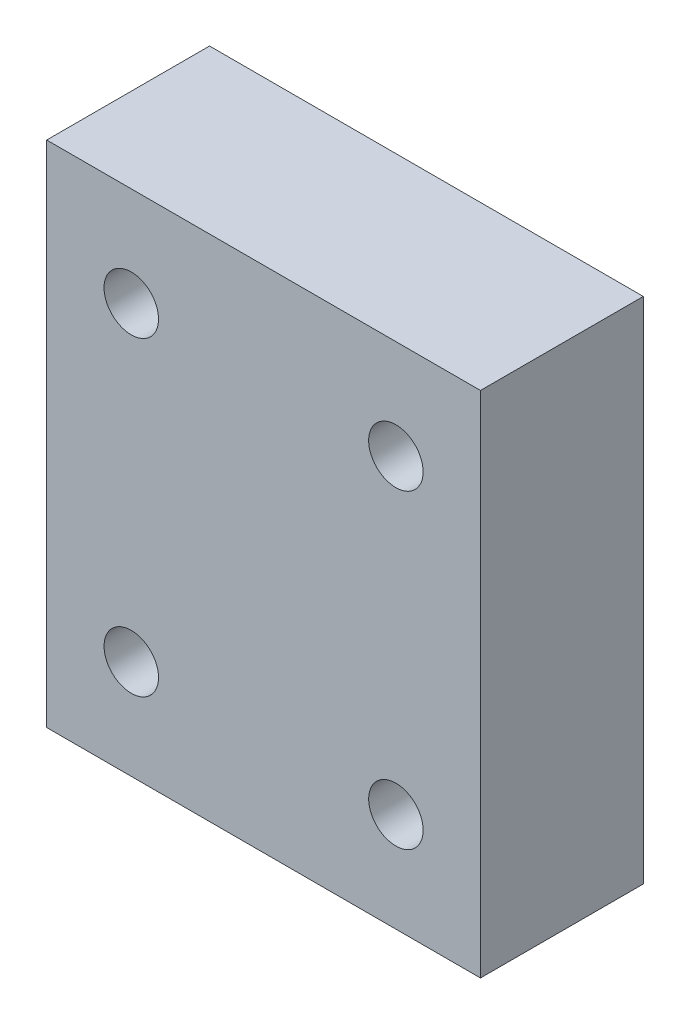
from build123d import *

# Parameters (mm, degrees)
SKETCH1_W           = 42.62295082
SKETCH1_H           = 50
SKETCH1_R           = 2.677018134
BOSS_EXTRUDE1_DEPTH = 16
SKETCH2_R           = 11
CUT_EXTRUDE2_DEPTH  = 11
SKETCH3_R           = 1.75
CUT_EXTRUDE3_DEPTH  = 10


with BuildPart() as part:
    # Sketch1 → Boss-Extrude1 (new body)
    with BuildSketch(Plane.XY):
        Rectangle(SKETCH1_W, SKETCH1_H)
        with Locations((-13, -15.25)):
            Circle(SKETCH1_R, mode=Mode.SUBTRACT)
        with Locations((13, -15.25)):
            Circle(SKETCH1_R, mode=Mode.SUBTRACT)
        with Locations((13, 15.25)):
            Circle(SKETCH1_R, mode=Mode.SUBTRACT)
        with Locations((-13, 15.25)):
            Circle(SKETCH1_R, mode=Mode.SUBTRACT)
    extrude(amount=BOSS_EXTRUDE1_DEPTH)

    # Sketch2 → Cut-Extrude2 (cut)
    with BuildSketch(Plane.XY):
        Circle(SKETCH2_R)
    extrude(amount=CUT_EXTRUDE2_DEPTH, mode=Mode.SUBTRACT)

    # Sketch3 → Cut-Extrude3 (cut)
    with BuildSketch(Plane(origin=(0, 0, 0), x_dir=(-1, 0, 0), z_dir=(0, 0, -1))):
        with Locations((-15, 0)):
            Circle(SKETCH3_R)
        with Locations((15, 0)):
            Circle(SKETCH3_R)
    extrude(amount=-CUT_EXTRUDE3_DEPTH, mode=Mode.SUBTRACT)


solid = part.part
